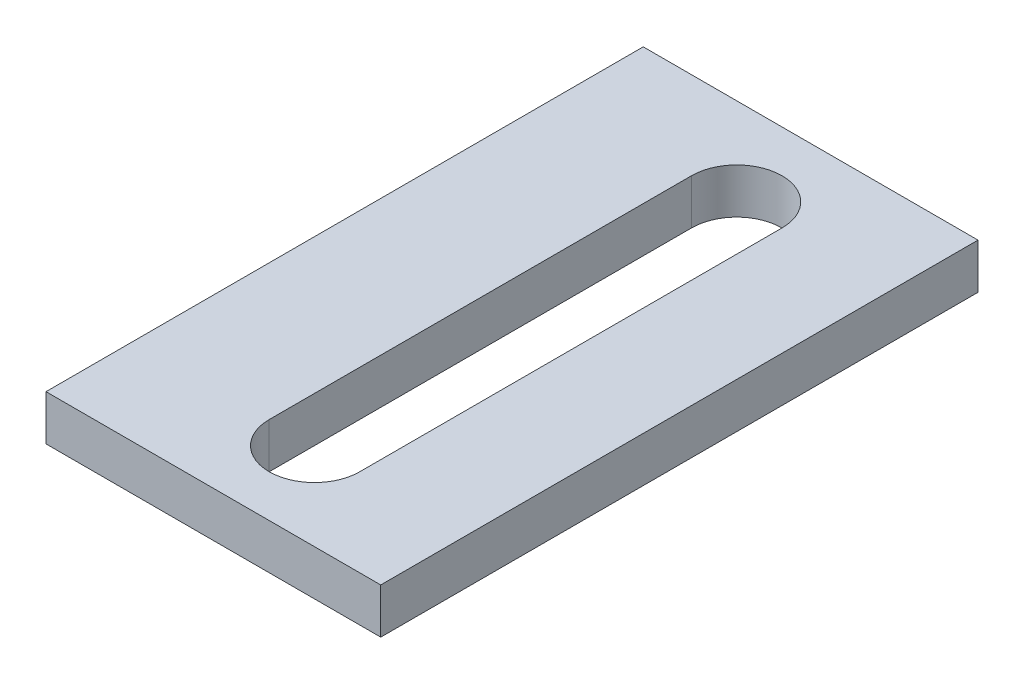
from build123d import *

# Parameters (mm, degrees)
SKETCH1_W               = 13.8
SKETCH1_H               = 8.8
BOSS_EXTRUDE1_DEPTH     = 3
SKETCH2_W               = 2
SKETCH2_H               = 35
BOSS_EXTRUDE2_DEPTH     = 3
SKETCH3_W               = 1.2
SKETCH3_H               = 6
BOSS_EXTRUDE3_DEPTH     = 7
FILLET3_R               = 10
SKETCH5_W               = 15
SKETCH5_H               = 13.8
BOSS_EXTRUDE4_DEPTH     = 4
SKETCH6_R               = 1.5
CUT_EXTRUDE4_DEPTH      = 38.968539608
BOSS_EXTRUDE5_DEPTH     = 2
CHAMFER2_SIZE           = 3
BOSS_EXTRUDE7_DEPTH     = 1.2
SKETCH12_W              = 15
SKETCH12_H              = 4
BOSS_EXTRUDE8_DEPTH     = 3
SKETCH13_W              = 15
SKETCH13_H              = 4
BOSS_EXTRUDE9_DEPTH     = 3
CUT_EXTRUDE7_DEPTH      = 43.28486727
CUT_EXTRUDE7_DEPTH_BACK = 43.28486727
CUT_EXTRUDE8_DEPTH      = 43.28486727
CUT_EXTRUDE8_DEPTH_BACK = 43.28486727
SKETCH15_W              = 0.807911756
SKETCH15_H              = 0.64
CUT_EXTRUDE9_DEPTH      = 41.244591358
CUT_EXTRUDE9_DEPTH_BACK = 41.244591358
SKETCH16_W              = 0.64
SKETCH16_H              = 0.6
CHAMFER3_SIZE           = 1
SKETCH18_W              = 20.701942652
SKETCH18_H              = 41.728044518
CUT_EXTRUDE10_DEPTH     = 36
SKETCH19_W              = 11.097134513
SKETCH19_H              = 20.928514419
CUT_EXTRUDE11_DEPTH     = 2.5


# Some blends are built 0.0001 mm under size
with BuildPart() as part:
    # Sketch1 → Boss-Extrude1 (new body)
    with BuildSketch(Plane(origin=(0, 0, 0), x_dir=(0, 0, -1), z_dir=(1, 0, 0))):
        Rectangle(SKETCH1_W, SKETCH1_H)
    extrude(amount=BOSS_EXTRUDE1_DEPTH)

    # Sketch2 → Boss-Extrude2 (add)
    with BuildSketch(Plane(origin=(3, 0, 0), x_dir=(0, 0, -1), z_dir=(1, 0, 0))):
        with Locations((0, -13.1)):
            Rectangle(SKETCH2_W, SKETCH2_H)
    extrude(amount=BOSS_EXTRUDE2_DEPTH)

    # Sketch3 → Boss-Extrude3 (add)
    with BuildSketch(Plane(origin=(6, 0, 0), x_dir=(0, 0, -1), z_dir=(1, 0, 0))):
        with Locations((0, -27.6)):
            Rectangle(SKETCH3_W, SKETCH3_H)
    extrude(amount=BOSS_EXTRUDE3_DEPTH)

    # Fillet3
    # the kernel refuses this fillet: 10 mm, written as the material it adds along each edge
    with BuildSketch(Plane(origin=(3, -4.4, 1), x_dir=(-1, 0, 0), z_dir=(0, 0, -1))) as fillet3_piece_1:
        with BuildLine():
            CenterArc((10, -7.141428429), FILLET3_R, 134.427004001, 45.572995999)
            Line((0, -7.141428429), (0, 0))
            Line((0, 0), (3, 0))
        make_face()
    extrude(amount=2)

    # Sketch5 → Boss-Extrude4 (add)
    with BuildSketch(Plane(origin=(0, 4.4, 0), x_dir=(1, 0, 0), z_dir=(0, 1, 0))):
        with Locations((-4.5, 0)):
            Rectangle(SKETCH5_W, SKETCH5_H)
    extrude(amount=BOSS_EXTRUDE4_DEPTH)

    # Sketch6 → Cut-Extrude4 (cut, through all)
    with BuildSketch(Plane.XZ.offset(-4.4)):
        with Locations(Location((-6, 3, 0), (0, 0, 270))):
            Circle(SKETCH6_R)
        with Locations(Location((-6, -3, 0), (0, 0, 270))):
            Circle(SKETCH6_R)
    extrude(amount=-CUT_EXTRUDE4_DEPTH, mode=Mode.SUBTRACT)

    # Sketch8 → Boss-Extrude5 (add)
    with BuildSketch(Plane(origin=(0, 0, -1), x_dir=(-1, 0, 0), z_dir=(0, 0, -1))):
        Polygon((-3, -18.758153574), (0, -4.4), (-3, -4.4), align=None)
    extrude(amount=-BOSS_EXTRUDE5_DEPTH)

    # Chamfer2
    chamfer2_edges = [part.edges().sort_by_distance(p)[0] for p in [
        (3, 4.4, 0),
    ]]
    chamfer(chamfer2_edges, length=CHAMFER2_SIZE - 0.0001)  # a hair under: the kernel refuses the full size

    # Sketch11 → Boss-Extrude7 (add)
    with BuildSketch(Plane(origin=(0, 0, -0.6), x_dir=(-1, 0, 0), z_dir=(0, 0, -1))):
        Polygon((-6, -24.6), (-13, -24.6), (-6, 1.742521041), align=None)
    extrude(amount=-BOSS_EXTRUDE7_DEPTH)

    # Sketch12 → Boss-Extrude8 (add)
    with BuildSketch(Plane(origin=(0, 0, -6.9), x_dir=(-1, 0, 0), z_dir=(0, 0, -1))):
        with Locations((4.5, 6.4)):
            Rectangle(SKETCH12_W, SKETCH12_H)
    extrude(amount=BOSS_EXTRUDE8_DEPTH)

    # Sketch13 → Boss-Extrude9 (add)
    with BuildSketch(Plane.XY.offset(6.9)):
        with Locations((-4.5, 6.4)):
            Rectangle(SKETCH13_W, SKETCH13_H)
    extrude(amount=BOSS_EXTRUDE9_DEPTH)

    # Sketch14 → Cut-Extrude7 (cut, two sides: drawn at the far end of the back side and taken through both)
    with BuildSketch(Plane(origin=(0, 8.4, 0), x_dir=(1, 0, 0), z_dir=(0, 1, 0)).offset(-CUT_EXTRUDE7_DEPTH_BACK)):
        with BuildLine():
            Line((-7.5, 7), (-7.5, -7))
            ThreePointArc((-7.5, -7), (-6, -8.5), (-4.5, -7))
            Line((-4.5, -7), (-4.5, 7))
            ThreePointArc((-4.5, 7), (-6, 8.5), (-7.5, 7))
        make_face()
    extrude(amount=CUT_EXTRUDE7_DEPTH + CUT_EXTRUDE7_DEPTH_BACK, mode=Mode.SUBTRACT)

    # Sketch15 → Cut-Extrude8 (cut, two sides: drawn at the far end of the back side and taken through both)
    with BuildSketch(Plane.XZ.offset(30.6).offset(-CUT_EXTRUDE8_DEPTH_BACK)):
        with Locations((12.596044122, 0)):
            Rectangle(SKETCH15_W, SKETCH15_H)
    extrude(amount=CUT_EXTRUDE8_DEPTH + CUT_EXTRUDE8_DEPTH_BACK, mode=Mode.SUBTRACT)

    # Sketch16 → Cut-Extrude9 (cut, two sides: drawn at the far end of the back side and taken through both)
    with BuildSketch(Plane(origin=(12.192088244, 0, 0), x_dir=(0, 0, -1), z_dir=(1, 0, 0)).offset(-CUT_EXTRUDE9_DEPTH_BACK)):
        with Locations((0, -30.3)):
            Rectangle(SKETCH16_W, SKETCH16_H)
    extrude(amount=CUT_EXTRUDE9_DEPTH + CUT_EXTRUDE9_DEPTH_BACK, mode=Mode.SUBTRACT)

    # Chamfer3
    chamfer3_edges = [part.edges().sort_by_distance(p)[0] for p in [
        (12.192088244, -30, 0),
    ]]
    chamfer(chamfer3_edges, length=CHAMFER3_SIZE)

    # Sketch18 → Cut-Extrude10 (cut)
    with BuildSketch(Plane.XY.offset(9.9)):
        with Locations((9.448105839, -12.464022259)):
            Rectangle(SKETCH18_W, SKETCH18_H)
    extrude(amount=-CUT_EXTRUDE10_DEPTH, mode=Mode.SUBTRACT)

    # Sketch19 → Cut-Extrude11 (cut)
    with BuildSketch(Plane.XZ.offset(-4.4)):
        with Locations((-6.451432743, 0.56425721)):
            Rectangle(SKETCH19_W, SKETCH19_H)
    extrude(amount=-CUT_EXTRUDE11_DEPTH, mode=Mode.SUBTRACT)


solid = part.part
